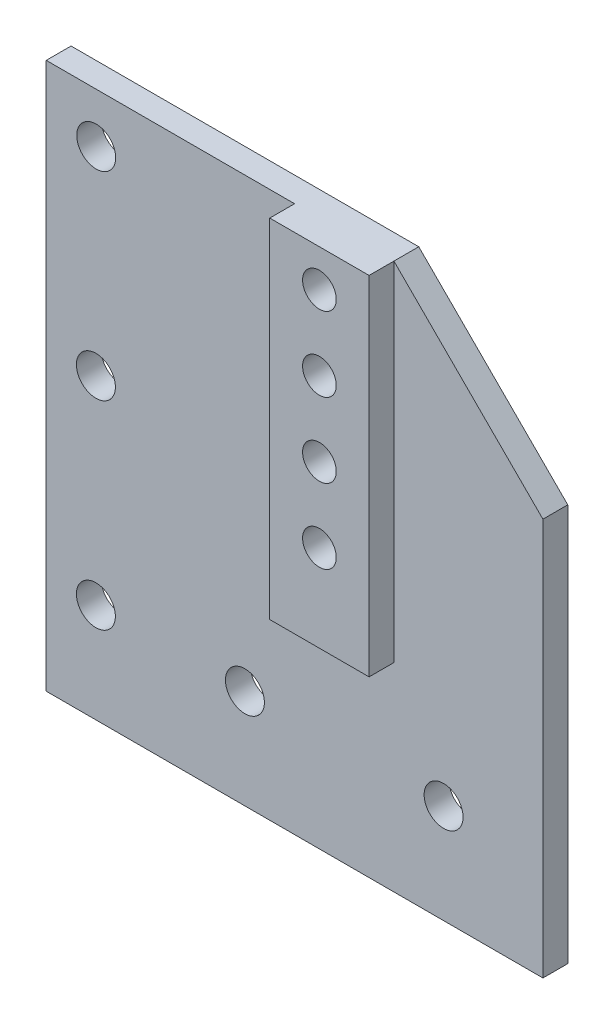
from build123d import *

# Parameters (mm, degrees)
BOSS_EXTRUDE1_DEPTH    = 3.175
F_10_CLEARANCE_HOLE1_D = 4.9784
BOSS_EXTRUDE2_DEPTH    = 3.175
F_8_CLEARANCE_HOLE1_D  = 4.3053


with BuildPart() as part:
    # Sketch1 → Boss-Extrude1 (new body)
    with BuildSketch(Plane.XY):
        Polygon((-254.000000508, -12.7), (-266.700000508, -12.7), (-266.700000508, 57.15), (-254.000000508, 57.15), (-222.250000508, 57.15), (-203.200000508, 38.1), (-203.200000508, 12.7), (-203.200000508, -12.7), align=None)
    extrude(amount=BOSS_EXTRUDE1_DEPTH)

    # #10 Clearance Hole1 (through all)
    with Locations(Plane.XY.offset(3.175)):
        with Locations((-260.311771093, 50.798866939), (-260.350000508, 25.4), (-260.350000508, 0), (-241.300000508, 0), (-215.900000508, 0)):
            Hole(F_10_CLEARANCE_HOLE1_D / 2)

    # Sketch5 → Boss-Extrude2 (add)
    with BuildSketch(Plane.XY.offset(3.175)):
        Polygon((-222.250000508, 57.15), (-234.950000508, 57.15), (-234.950000508, 12.7), (-222.250000508, 12.7), (-222.250000508, 50.8), align=None)
    extrude(amount=BOSS_EXTRUDE2_DEPTH)

    # #8 Clearance Hole1 (through all)
    with Locations(Plane.XY.offset(6.35)):
        with Locations((-228.600000508, 42.8625), (-228.600000508, 52.3875), (-228.600000508, 33.3375), (-228.600000508, 23.8125)):
            Hole(F_8_CLEARANCE_HOLE1_D / 2)


solid = part.part
